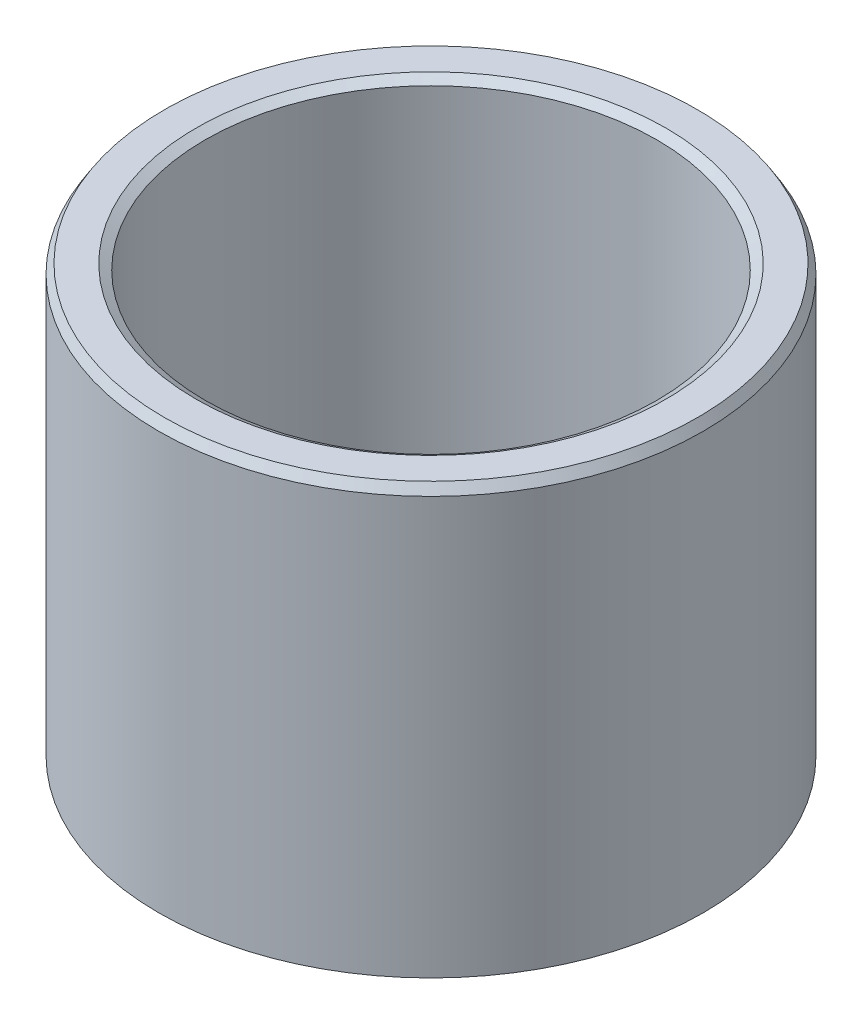
from build123d import *
from OCP.BRepFilletAPI import BRepFilletAPI_MakeChamfer

# Parameters (mm, degrees)
SKETCH1_R           = 30
BOSS_EXTRUDE1_DEPTH = 47.584271128
SKETCH2_R           = 24.881489147
CUT_EXTRUDE1_DEPTH  = 64.751571422
CHAMFER1_SIZE       = 1.006779777
CHAMFER1_SIZE2      = 0.61879312


with BuildPart() as part:
    # Sketch1 → Boss-Extrude1 (new body)
    with BuildSketch(Plane(origin=(0, 0, 0), x_dir=(1, 0, 0), z_dir=(0, 1, 0))):
        Circle(SKETCH1_R)
    extrude(amount=BOSS_EXTRUDE1_DEPTH)

    # Sketch2 → Cut-Extrude1 (cut, through all)
    with BuildSketch(Plane(origin=(0, 0, 0), x_dir=(1, 0, 0), z_dir=(0, 1, 0))):
        Circle(SKETCH2_R)
    extrude(amount=CUT_EXTRUDE1_DEPTH, mode=Mode.SUBTRACT)

    # Chamfer1: one chamfer whose edges measure the first distance from different faces: ONE call of the kernel's chamfer builder (chamfer() names one face for all edges)
    chamfer1_edges_1 = [part.edges().sort_by_distance(p)[0] for p in [
        (-24.881489147, 47.584271128, 0),
    ]]
    chamfer1_side_1 = [part.faces().sort_by_distance(p)[0] for p in [
        (-29.151471863, 47.584271128, 0),
    ]]
    chamfer1_edges_2 = [part.edges().sort_by_distance(p)[0] for p in [
        (-24.881489147, 0, 0),
    ]]
    chamfer1_side_2 = [part.faces().sort_by_distance(p)[0] for p in [
        (-24.881489147, 23.792135564, 0),
    ]]
    chamfer1_edges_3 = [part.edges().sort_by_distance(p)[0] for p in [
        (-30, 0, 0),
    ]]
    chamfer1_side_3 = [part.faces().sort_by_distance(p)[0] for p in [
        (-29.151471863, 0, 0),
    ]]
    chamfer1_edges_4 = [part.edges().sort_by_distance(p)[0] for p in [
        (-30, 47.584271128, 0),
    ]]
    chamfer1_side_4 = [part.faces().sort_by_distance(p)[0] for p in [
        (-30, 23.792135564, 0),
    ]]
    chamfer1 = BRepFilletAPI_MakeChamfer(part.part.solid().wrapped)
    for e in chamfer1_edges_1:
        chamfer1.Add(CHAMFER1_SIZE, CHAMFER1_SIZE2, e.wrapped, chamfer1_side_1[0].wrapped)  # the first distance lies on this face
    for e in chamfer1_edges_2:
        chamfer1.Add(CHAMFER1_SIZE, CHAMFER1_SIZE2, e.wrapped, chamfer1_side_2[0].wrapped)  # the first distance lies on this face
    for e in chamfer1_edges_3:
        chamfer1.Add(CHAMFER1_SIZE, CHAMFER1_SIZE2, e.wrapped, chamfer1_side_3[0].wrapped)  # the first distance lies on this face
    for e in chamfer1_edges_4:
        chamfer1.Add(CHAMFER1_SIZE, CHAMFER1_SIZE2, e.wrapped, chamfer1_side_4[0].wrapped)  # the first distance lies on this face
    add(Compound.cast(chamfer1.Shape()), mode=Mode.REPLACE)


solid = part.part
